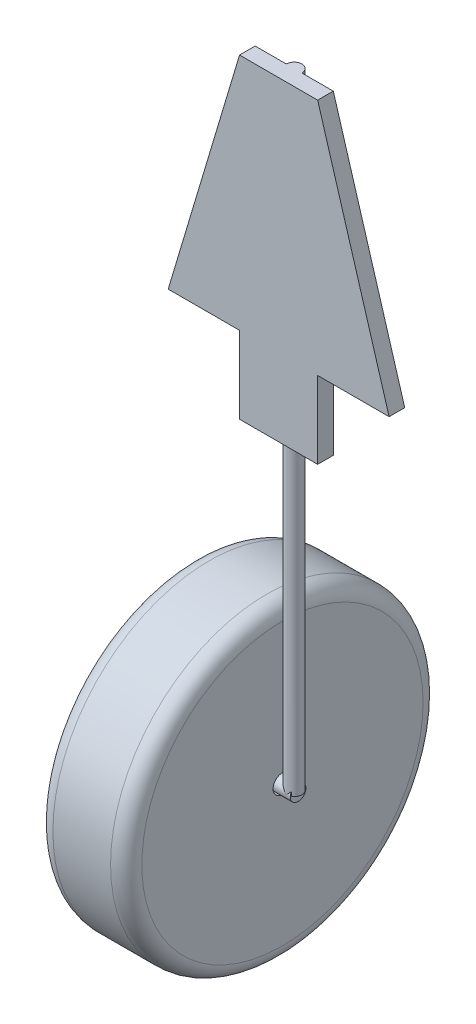
from build123d import *

# Parameters (mm, degrees)
SKETCH1_R                = 10
SKETCH1_R_2              = 0.6
BOSS_EXTRUDE1_DEPTH      = 5.69
FILLET2_R                = 1
FILLET3_R                = 1
BOSS_EXTRUDE2_DEPTH      = 1
BOSS_EXTRUDE2_DEPTH_BACK = 6
SKETCH2_R                = 0.5
SKETCH4_R                = 0.5
BOSS_EXTRUDE5_DEPTH      = 40
BOSS_EXTRUDE8_DEPTH      = 1


with BuildPart() as part:
    # Sketch1 → Boss-Extrude1 (new body)
    with BuildSketch(Plane(origin=(0, 0, 0), x_dir=(0, 0, -1), z_dir=(1, 0, 0))):
        Circle(SKETCH1_R)
        Circle(SKETCH1_R_2, mode=Mode.SUBTRACT)
    extrude(amount=BOSS_EXTRUDE1_DEPTH)

    # Fillet2
    fillet2_edges = [part.edges().sort_by_distance(p)[0] for p in [
        (0, 0, 10),
    ]]
    fillet(fillet2_edges, radius=FILLET2_R)

    # Fillet3
    fillet3_edges = [part.edges().sort_by_distance(p)[0] for p in [
        (5.69, 0, 10),
    ]]
    fillet(fillet3_edges, radius=FILLET3_R)


with BuildPart() as body_2:
    # Sketch2 → Boss-Extrude2 (new, two sides: drawn at the far end of the back side and taken through both)
    with BuildSketch(Plane(origin=(5.69, 0, 0), x_dir=(0, 0, -1), z_dir=(1, 0, 0)).offset(-BOSS_EXTRUDE2_DEPTH_BACK)):
        Circle(SKETCH2_R)
    extrude(amount=BOSS_EXTRUDE2_DEPTH + BOSS_EXTRUDE2_DEPTH_BACK)

    # Sketch4 → Boss-Extrude5 (add)
    with BuildSketch(Plane(origin=(0, 0, 0), x_dir=(1, 0, 0), z_dir=(0, 1, 0))):
        with Locations((6.434798772, 0)):
            Circle(SKETCH4_R)
    extrude(amount=BOSS_EXTRUDE5_DEPTH)

    # Sketch14 → Boss-Extrude8 (add)
    with BuildSketch(Plane.XY):
        Polygon((8.942784632, 40), (3.942784632, 40), (-0.623188676, 24.742004498), (3.942784632, 24.742004498), (3.942784632, 19.814002531), (8.942784632, 19.814002531), (8.942784632, 24.742004498), (13.516031921, 24.742004498), align=None)
    extrude(amount=BOSS_EXTRUDE8_DEPTH)


solid = Compound([part.part, body_2.part])
